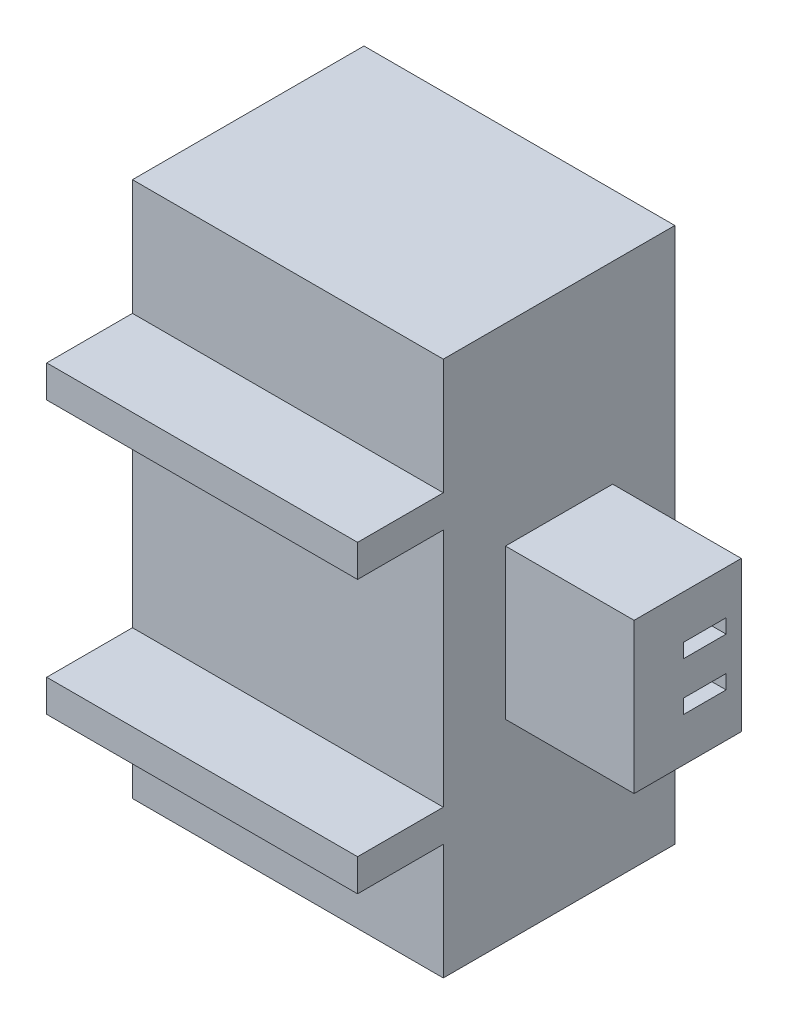
from build123d import *

# Parameters (mm, degrees)
SKETCH1_W           = 7.25
SKETCH1_H           = 12.5
BOSS_EXTRUDE1_DEPTH = 7.4
SKETCH2_W           = 2
SKETCH2_H           = 2.700167795
SKETCH2_H_2         = 5.59966441
CUT_EXTRUDE1_DEPTH  = 17.234916076
SKETCH3_W           = 2.5
SKETCH3_H           = 3.5
SKETCH3_W_2         = 1
SKETCH3_H_2         = 0.331350256
BOSS_EXTRUDE2_DEPTH = 3


with BuildPart() as part:
    # Sketch1 → Boss-Extrude1 (new body)
    with BuildSketch(Plane.XY):
        with Locations((3.625, 6.25)):
            Rectangle(SKETCH1_W, SKETCH1_H)
    extrude(amount=BOSS_EXTRUDE1_DEPTH)

    # Sketch2 → Cut-Extrude1 (cut, through all)
    with BuildSketch(Plane(origin=(7.25, 0, 0), x_dir=(0, 0, -1), z_dir=(1, 0, 0))):
        with Locations((-6.4, 11.149916103)):
            Rectangle(SKETCH2_W, SKETCH2_H)
        with Locations((-6.4, 1.350083898)):
            Rectangle(SKETCH2_W, SKETCH2_H)
        with Locations((-6.4, 6.25)):
            Rectangle(SKETCH2_W, SKETCH2_H_2)
    extrude(amount=-CUT_EXTRUDE1_DEPTH, mode=Mode.SUBTRACT)

    # Sketch3 → Boss-Extrude2 (add)
    with BuildSketch(Plane(origin=(7.25, 0, 0), x_dir=(0, 0, -1), z_dir=(1, 0, 0))):
        with Locations((-2.7, 6.25)):
            Rectangle(SKETCH3_W, SKETCH3_H)
        with Locations((-2.303664878, 5.686580017)):
            Rectangle(SKETCH3_W_2, SKETCH3_H_2, mode=Mode.SUBTRACT)
        with Locations((-2.303664878, 6.813419983)):
            Rectangle(SKETCH3_W_2, SKETCH3_H_2, mode=Mode.SUBTRACT)
    extrude(amount=BOSS_EXTRUDE2_DEPTH)


solid = part.part
